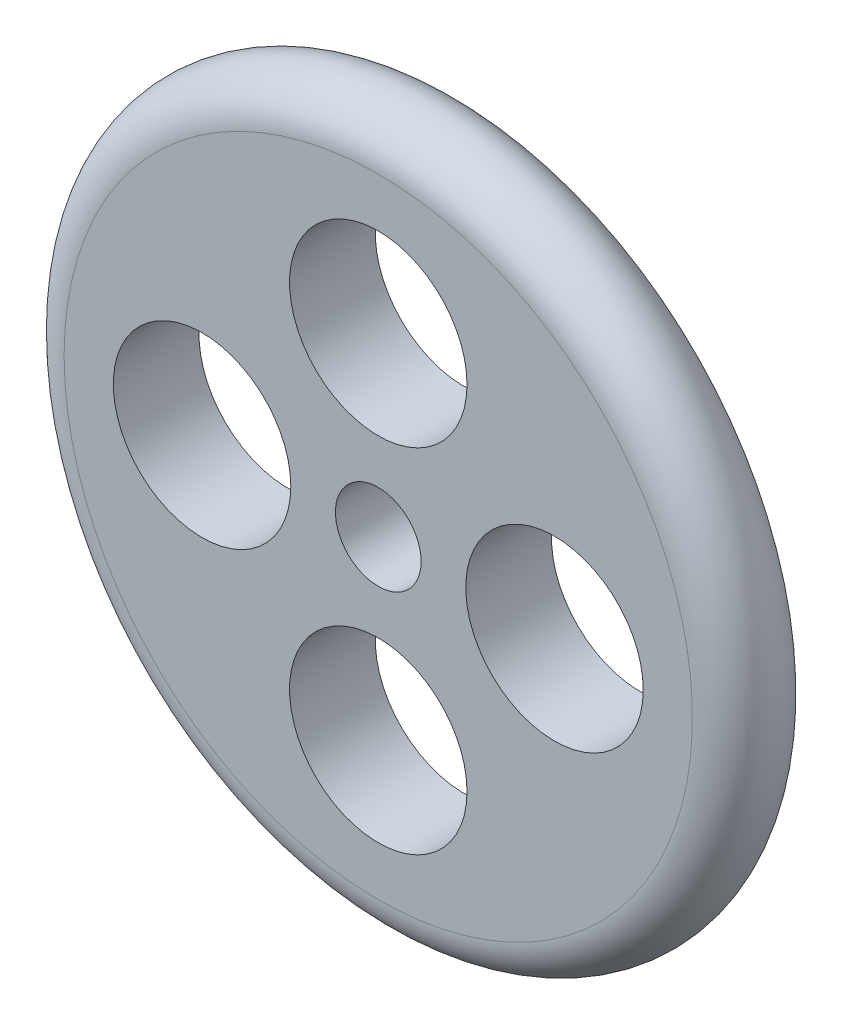
from build123d import *

# Parameters (mm, degrees)
SKETCH10_R         = 15
CUT_EXTRUDE1_DEPTH = 180.304211864
SKETCH11_R         = 31.072505877
CUT_EXTRUDE2_DEPTH = 180.304211864


with BuildPart() as part:
    # Sketch6 → Revolve3 (revolve)
    with BuildSketch(Plane(origin=(0, 0, 0), x_dir=(1, 0, 0), z_dir=(0, 1, 0))):
        with BuildLine():
            Line((-1.369e-06, 75.786874096), (109.999998631, 75.786874096))
            ThreePointArc((109.999998631, 75.786874096), (124.999998631, 60.786874096), (109.999998631, 45.786874096))
            Line((109.999998631, 45.786874096), (-1.369e-06, 45.786874096))
            Line((-1.369e-06, 45.786874096), (-1.369e-06, 75.786874096))
        make_face()
    revolve(axis=Axis((-1.369e-06, 0, -75.786874096), (0, 0, 1)))

    # Sketch10 → Cut-Extrude1 (cut, through all)
    with BuildSketch(Plane.XY.offset(-45.786874096)):
        Circle(SKETCH10_R)
    extrude(amount=-CUT_EXTRUDE1_DEPTH, mode=Mode.SUBTRACT)

    # Sketch11 → Cut-Extrude2 (cut, through all)
    with BuildSketch(Plane.XY.offset(-45.786874096)):
        with Locations((0, 61.701118812)):
            Circle(SKETCH11_R)
        with Locations((61.701118812, 0)):
            Circle(SKETCH11_R)
        with Locations((0, -61.701118812)):
            Circle(SKETCH11_R)
        with Locations((-61.701118812, 0)):
            Circle(SKETCH11_R)
    extrude(amount=-CUT_EXTRUDE2_DEPTH, mode=Mode.SUBTRACT)


solid = part.part
